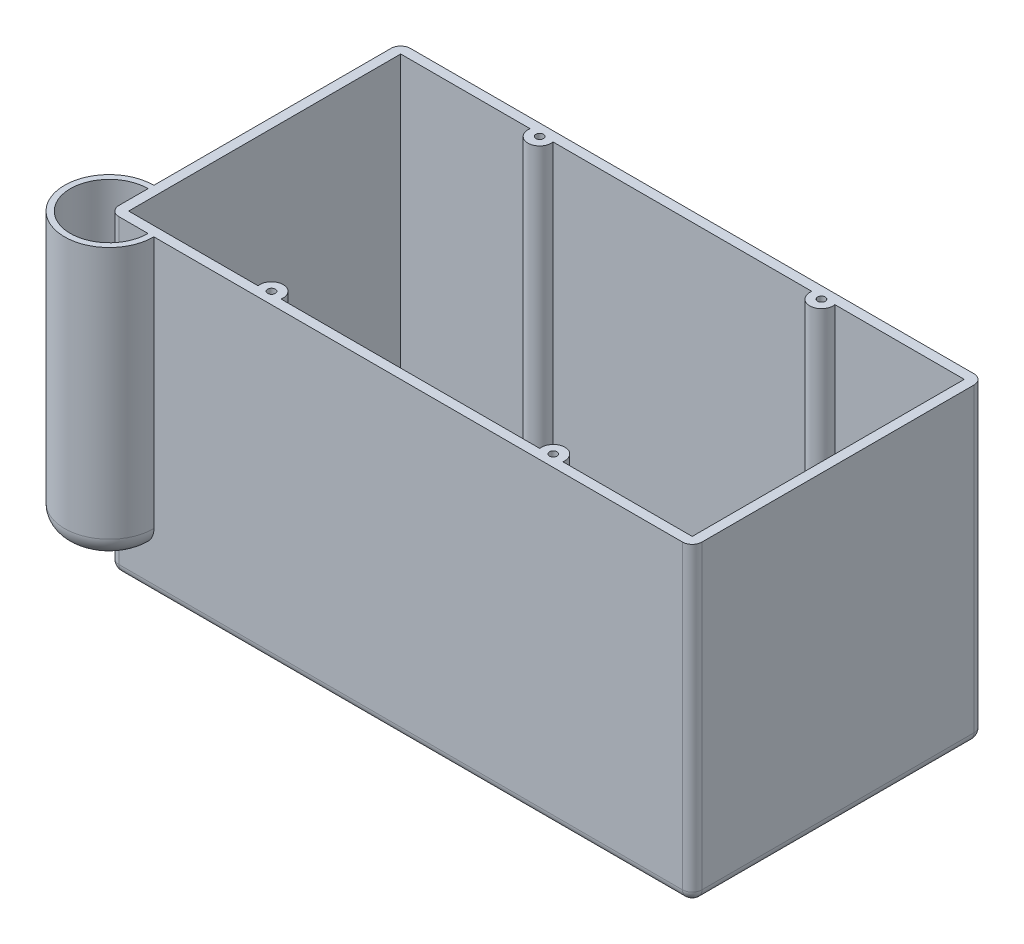
from build123d import *

# Parameters (mm, degrees)
ESQUISSE1_W             = 300
ESQUISSE1_H             = 150
BOSS_EXTRU_1_DEPTH      = 5
ESQUISSE3_W             = 300
ESQUISSE3_H             = 150
ESQUISSE3_W_2           = 290
ESQUISSE3_H_2           = 140
BOSS_EXTRU_2_DEPTH      = 155
ESQUISSE4_R             = 6
BOSS_EXTRU_4_DEPTH      = 155
ESQUISSE5_R             = 1.95
ENL_V_MAT_EXTRU_1_DEPTH = 6
ESQUISSE6_R             = 20
ENL_V_MAT_EXTRU_2_DEPTH = 5
ESQUISSE7_R             = 20
ENL_V_MAT_EXTRU_3_DEPTH = 5
ESQUISSE8_R             = 23
ESQUISSE8_R_2           = 20
BOSS_EXTRU_5_DEPTH      = 140
BOSS_EXTRU_6_START      = -3
ESQUISSE9_R             = 20
BOSS_EXTRU_6_DEPTH      = 3
BOSS_EXTRU_7_DEPTH      = 3
CONG_1_R                = 10
CONG_2_R                = 5
CONG_3_R                = 5
ESQUISSE12_W            = 17.449944321
ESQUISSE12_H            = 17.449944321
ENL_V_MAT_EXTRU_5_DEPTH = 152


# Some blends are built 0.0001 mm under size
with BuildPart() as part:
    # Esquisse1 → Boss.-Extru.1 (new body)
    with BuildSketch(Plane(origin=(0, 0, 0), x_dir=(1, 0, 0), z_dir=(0, 1, 0))):
        Rectangle(ESQUISSE1_W, ESQUISSE1_H)
    extrude(amount=BOSS_EXTRU_1_DEPTH)

    # Esquisse3 → Boss.-Extru.2 (add)
    with BuildSketch(Plane(origin=(0, 5, 0), x_dir=(1, 0, 0), z_dir=(0, 1, 0))):
        Rectangle(ESQUISSE3_W, ESQUISSE3_H)
        Rectangle(ESQUISSE3_W_2, ESQUISSE3_H_2, mode=Mode.SUBTRACT)
    extrude(amount=BOSS_EXTRU_2_DEPTH)

    # Esquisse4 → Boss.-Extru.4 (add)
    with BuildSketch(Plane(origin=(0, 5, 0), x_dir=(1, 0, 0), z_dir=(0, 1, 0))):
        with Locations((-72.5, 69)):
            Circle(ESQUISSE4_R)
        with Locations((72.5, 69)):
            Circle(ESQUISSE4_R)
        with Locations((72.5, -69)):
            Circle(ESQUISSE4_R)
        with Locations((-72.5, -69)):
            Circle(ESQUISSE4_R)
    extrude(amount=BOSS_EXTRU_4_DEPTH)

    # Esquisse5 → Enlèv. mat.-Extru.1 (cut)
    with BuildSketch(Plane(origin=(0, 160, 0), x_dir=(1, 0, 0), z_dir=(0, 1, 0))):
        with Locations(Location((-72.5, 69, 0), (0, 0, 270))):
            Circle(ESQUISSE5_R)
        with Locations(Location((72.5, 69, 0), (0, 0, 90))):
            Circle(ESQUISSE5_R)
        with Locations(Location((72.5, -69, 0), (0, 0, 270))):
            Circle(ESQUISSE5_R)
        with Locations(Location((-72.5, -69, 0), (0, 0, 90))):
            Circle(ESQUISSE5_R)
    extrude(amount=-ENL_V_MAT_EXTRU_1_DEPTH, mode=Mode.SUBTRACT)

    # Esquisse6 → Enlèv. mat.-Extru.2 (cut)
    with BuildSketch(Plane.XY.offset(75)):
        with Locations((-150, 50)):
            Circle(ESQUISSE6_R)
    extrude(amount=-ENL_V_MAT_EXTRU_2_DEPTH, mode=Mode.SUBTRACT)

    # Esquisse7 → Enlèv. mat.-Extru.3 (cut)
    with BuildSketch(Plane.ZY.offset(150)):
        with Locations((75, 50)):
            Circle(ESQUISSE7_R)
    extrude(amount=-ENL_V_MAT_EXTRU_3_DEPTH, mode=Mode.SUBTRACT)

    # Esquisse8 → Boss.-Extru.5 (add)
    with BuildSketch(Plane(origin=(0, 160, 0), x_dir=(1, 0, 0), z_dir=(0, 1, 0))):
        with Locations((-150, -75)):
            Circle(ESQUISSE8_R)
        with Locations((-150, -75)):
            Circle(ESQUISSE8_R_2, mode=Mode.SUBTRACT)
    extrude(amount=-BOSS_EXTRU_5_DEPTH)

    # Esquisse9 → Boss.-Extru.6 (add)
    with BuildSketch(Plane.XZ.offset(-20).offset(BOSS_EXTRU_6_START)):
        with Locations((-150, 75)):
            Circle(ESQUISSE9_R)
    extrude(amount=BOSS_EXTRU_6_DEPTH)

    # Esquisse10 → Boss.-Extru.7 (add)
    with BuildSketch(Plane(origin=(0, 160, 0), x_dir=(1, 0, 0), z_dir=(0, 1, 0))):
        with BuildLine():
            Line((-150, -52), (-150, -75))
            Line((-150, -75), (-127, -75))
            ThreePointArc((-127, -75), (-133.736544033, -58.736544033), (-150, -52))
        make_face()
    extrude(amount=-BOSS_EXTRU_7_DEPTH)

    # Congé1
    cong_1_edges = [part.edges().sort_by_distance(p)[0] for p in [
        (-166.263455967, 20, 91.263455967),
    ]]
    fillet(cong_1_edges, radius=CONG_1_R)

    # Congé2
    cong_2_edges = [part.edges().sort_by_distance(p)[0] for p in [
        (0, 0, -75),
        (150, 0, 0),
        (0, 0, 75),
        (-150, 0, 0),
    ]]
    fillet(cong_2_edges, radius=CONG_2_R - 0.0001)  # a hair under: the kernel refuses the full size

    # Congé3
    # the kernel refuses this fillet: 5 mm, written as the material it takes off along each edge
    with BuildSketch(Plane(origin=(-145, 0, 70), x_dir=(0, 0, 1), z_dir=(1, 0, 0))) as cong_3_piece_1:
        with BuildLine():
            CenterArc((0.0001, -4.9999), 4.9999, 0, 90)
            Line((5, -4.9999), (5, 0))
            Line((5, 0), (0.0001, 0))
        make_face()
    revolve(axis=Axis((-145, 0, 70), (0, -1, 0)), revolution_arc=90, mode=Mode.SUBTRACT)
    with BuildSketch(Plane(origin=(-145, 0, -70), x_dir=(-1, 0, 0), z_dir=(0, 0, 1))) as cong_3_piece_2:
        with BuildLine():
            CenterArc((0.0001, -4.9999), 4.9999, 0, 90)
            Line((5, -4.9999), (5, 0))
            Line((5, 0), (0.0001, 0))
        make_face()
    revolve(axis=Axis((-145, 0, -70), (0, -1, 0)), revolution_arc=90, mode=Mode.SUBTRACT)
    with BuildSketch(Plane(origin=(145, 0, -70), x_dir=(0, 0, -1), z_dir=(-1, 0, 0))) as cong_3_piece_3:
        with BuildLine():
            CenterArc((0.0001, -4.9999), 4.9999, 0, 90)
            Line((5, -4.9999), (5, 0))
            Line((5, 0), (0.0001, 0))
        make_face()
    revolve(axis=Axis((145, 0, -70), (0, -1, 0)), revolution_arc=90, mode=Mode.SUBTRACT)
    with BuildSketch(Plane(origin=(145, 0, 70), x_dir=(1, 0, 0), z_dir=(0, 0, -1))) as cong_3_piece_4:
        with BuildLine():
            CenterArc((0.0001, -4.9999), 4.9999, 0, 90)
            Line((5, -4.9999), (5, 0))
            Line((5, 0), (0.0001, 0))
        make_face()
    revolve(axis=Axis((145, 0, 70), (0, -1, 0)), revolution_arc=90, mode=Mode.SUBTRACT)
    with BuildSketch(Plane(origin=(-150, 20, 75), x_dir=(1, 0, 0), z_dir=(0, -1, 0))) as cong_3_piece_5:
        with BuildLine():
            CenterArc((CONG_3_R, -CONG_3_R), CONG_3_R, 90, 90)
            Line((0, -CONG_3_R), (0, 0))
            Line((0, 0), (CONG_3_R, 0))
        make_face()
    extrude(amount=20, mode=Mode.SUBTRACT)
    with BuildSketch(Plane(origin=(-150, 172.5, 75), x_dir=(1, 0, 0), z_dir=(0, -1, 0))) as cong_3_piece_6:
        with BuildLine():
            CenterArc((CONG_3_R, -CONG_3_R), CONG_3_R, 90, 90)
            Line((0, -CONG_3_R), (0, 0))
            Line((0, 0), (CONG_3_R, 0))
        make_face()
    extrude(amount=115, mode=Mode.SUBTRACT)
    with BuildSketch(Plane(origin=(-150, 172.5, -75), x_dir=(0, 0, 1), z_dir=(0, -1, 0)), Plane(origin=(150, 0, -75), x_dir=(0, 0, 1), z_dir=(0, 1, 0)), Plane(origin=(150, 0, 75), x_dir=(-1, 0, 0), z_dir=(0, 1, 0))) as cong_3_piece_7:
        with BuildLine():
            CenterArc((CONG_3_R, -CONG_3_R), CONG_3_R, 90, 90)
            Line((0, -CONG_3_R), (0, 0))
            Line((0, 0), (CONG_3_R, 0))
        make_face()
    extrude(amount=172.5, mode=Mode.SUBTRACT)

    # Esquisse12 → Enlèv. mat.-Extru.5 (cut)
    with BuildSketch(Plane(origin=(0, 160, 0), x_dir=(1, 0, 0), z_dir=(0, 1, 0))):
        with Locations((-136.27502784, -61.275027839)):
            Rectangle(ESQUISSE12_W, ESQUISSE12_H)
    extrude(amount=-ENL_V_MAT_EXTRU_5_DEPTH, mode=Mode.SUBTRACT)


solid = part.part
